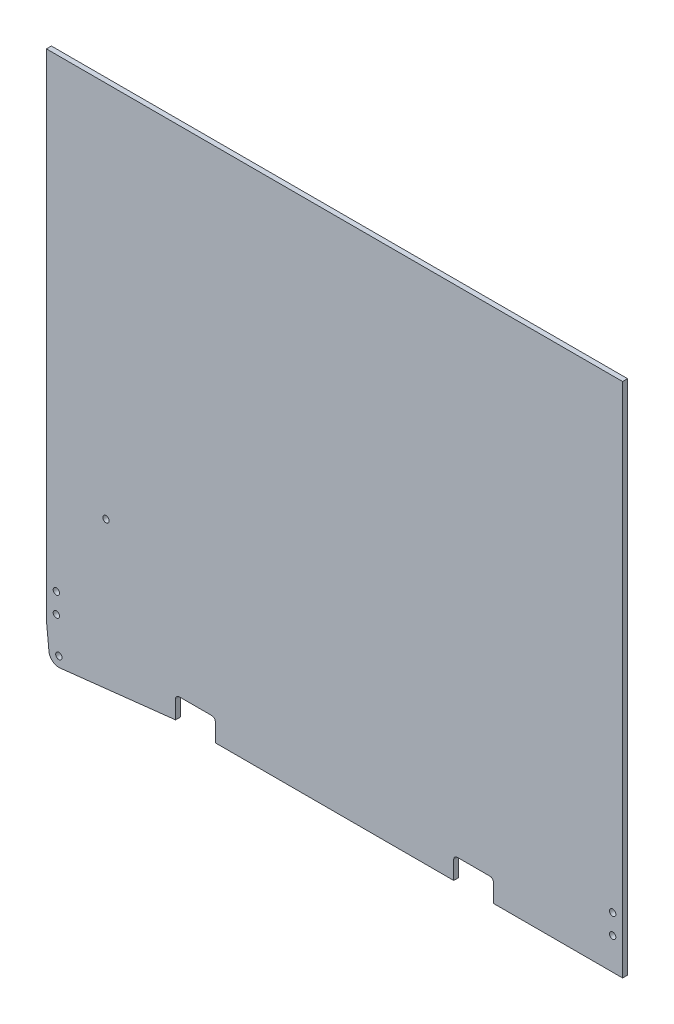
from build123d import *

# Parameters (mm, degrees)
SKETCH1_R           = 2.032
BOSS_EXTRUDE1_DEPTH = 3.175
FILLET1_R           = 2.286


with BuildPart() as part:
    # Sketch1 → Boss-Extrude1 (new body)
    with BuildSketch(Plane.XY):
        with BuildLine():
            Line((82.55, -20.32), (82.55, -6.35))
            Line((82.55, -6.35), (107.95, -6.35))
            Line((107.95, -6.35), (107.95, -20.32))
            Line((107.95, -20.32), (260.35, -20.32))
            Line((260.35, -20.32), (260.35, -6.35))
            Line((260.35, -6.35), (285.75, -6.35))
            Line((285.75, -6.35), (285.75, -20.32))
            Line((285.75, -20.32), (368.3, -20.32))
            Line((368.3, -20.32), (368.3, 309.88))
            Line((368.3, 309.88), (0, 309.88))
            Line((0, 309.88), (0, 0))
            Line((0, 0), (0, -6.35))
            ThreePointArc((0, -6.35), (0.007883354, -6.666317007), (0.031513842, -6.981848616))
            Line((0.031513842, -6.981848616), (1.619013842, -22.856848616))
            ThreePointArc((1.619013842, -22.856848616), (3.943628298, -27.161748811), (8.639060666, -28.536126099))
            Line((8.639060666, -28.536126099), (82.55, -20.32))
        make_face()
        with Locations((6.35, 0)):
            Circle(SKETCH1_R, mode=Mode.SUBTRACT)
        with Locations((6.35, 12.7)):
            Circle(SKETCH1_R, mode=Mode.SUBTRACT)
        with Locations((361.95, 0)):
            Circle(SKETCH1_R, mode=Mode.SUBTRACT)
        with Locations((361.95, 12.7)):
            Circle(SKETCH1_R, mode=Mode.SUBTRACT)
        with Locations((7.9375, -22.225)):
            Circle(SKETCH1_R, mode=Mode.SUBTRACT)
        with Locations((38.1, 68.58)):
            Circle(SKETCH1_R, mode=Mode.SUBTRACT)
    extrude(amount=BOSS_EXTRUDE1_DEPTH)

    # Fillet1
    fillet1_edges = [part.edges().sort_by_distance(p)[0] for p in [
        (285.75, -6.35, 1.5875),
        (107.95, -6.35, 1.5875),
        (260.35, -6.35, 1.5875),
        (82.55, -6.35, 1.5875),
    ]]
    fillet(fillet1_edges, radius=FILLET1_R)


solid = part.part
